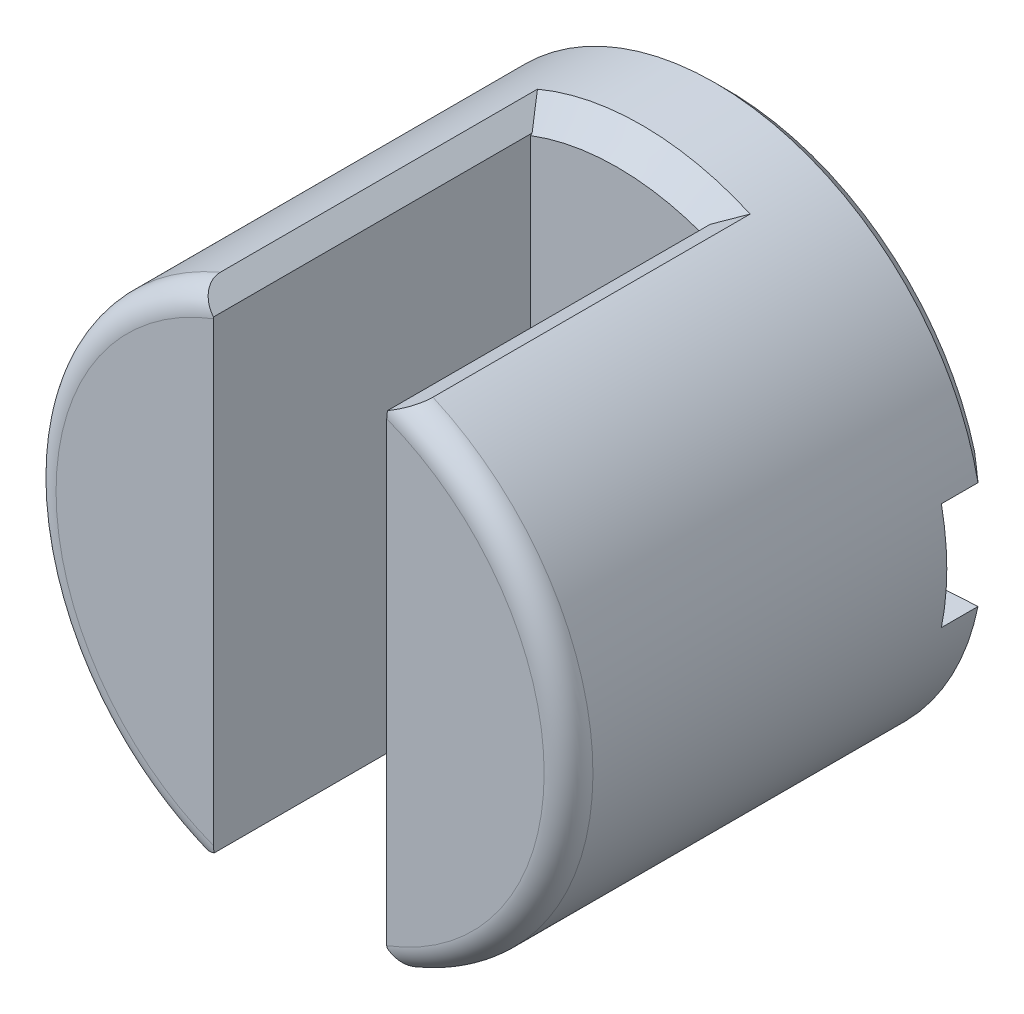
from build123d import *

# Parameters (mm, degrees)
PILL_SLOT_DEPTH           = 13
BASE_START                = -4.5
SKETCH2_5_R               = 11
BASE_DEPTH                = 4.5
SKETCH3_R                 = 3.5
SERVO_ROTATION_SLOT_DEPTH = 2
CHAMFER1_SIZE             = 0.787885924
CHAMFER1_SIZE_2           = 1
FILLET1_R                 = 1
CHAMFER2_SIZE             = 0.5
CHAMFER4_SIZE             = 1


with BuildPart() as part:
    # Sketch2 → Pill Slot (new body)
    with BuildSketch(Plane.XY):
        with BuildLine():
            ThreePointArc((11, 0), (8.945669343, 6.401171768), (3.55, 10.411412008))
            Line((3.55, 10.411412008), (3.55, 0))
            Line((3.55, 0), (11, 0))
        make_face()
        with BuildLine():
            Line((11, 0), (3.55, 0))
            Line((3.55, 0), (3.55, -10.411412008))
            ThreePointArc((3.55, -10.411412008), (8.945669343, -6.401171768), (11, 0))
        make_face()
        with BuildLine():
            Line((-3.55, -10.411412008), (-3.55, 10.411412008))
            ThreePointArc((-3.55, 10.411412008), (-11, 0), (-3.55, -10.411412008))
        make_face()
    extrude(amount=PILL_SLOT_DEPTH)

    # Sketch2<5> → Base (add)
    with BuildSketch(Plane.XY.offset(BASE_START)):
        with Locations(Location((0, 0, 0), (0, 0, 108.827939217))):
            Circle(SKETCH2_5_R)
    extrude(amount=BASE_DEPTH)

    # Sketch3 → Servo Rotation slot (cut)
    with BuildSketch(Plane(origin=(0, 0, -4.5), x_dir=(-1, 0, 0), z_dir=(0, 0, -1))):
        with BuildLine():
            Line((-2.227105745, 2.7), (-10.778529281, 2.196202755))
            ThreePointArc((-10.778529281, 2.196202755), (-11, 0), (-10.778529281, -2.196202755))
            Line((-10.778529281, -2.196202755), (-2.227105745, -2.7))
            ThreePointArc((-2.227105745, -2.7), (-3.5, 0), (-2.227105745, 2.7))
        make_face()
        Circle(SKETCH3_R)
        with BuildLine():
            ThreePointArc((11, 0), (10.94449227, 1.103670673), (10.778529281, 2.196202755))
            Line((10.778529281, 2.196202755), (2.227105745, 2.7))
            ThreePointArc((2.227105745, 2.7), (3.165822966, 1.492502913), (3.5, 0))
            ThreePointArc((3.5, 0), (3.165822966, -1.492502913), (2.227105745, -2.7))
            Line((2.227105745, -2.7), (10.778529281, -2.196202755))
            ThreePointArc((10.778529281, -2.196202755), (10.94449227, -1.103670673), (11, 0))
        make_face()
    extrude(amount=-SERVO_ROTATION_SLOT_DEPTH, mode=Mode.SUBTRACT)

    # Chamfer1
    # the kernel refuses this chamfer: 1, 0.787885924 mm, written as the material it takes off along each edge
    with BuildSketch(Plane(origin=(3.55, 10.411412008, 0), x_dir=(0.9315227050820926, -0.36368317244071224, 0), z_dir=(0, 0, 1))) as chamfer1_piece_1:
        with BuildLine():
            Line((0.959099491, 0), (CHAMFER1_SIZE * 0.363683172432, -CHAMFER1_SIZE * 0.93152270506))
            Line((CHAMFER1_SIZE * 0.363683172432, -CHAMFER1_SIZE * 0.93152270506), (0, 0))
            ThreePointArc((0, 0), (0.493056629, 0.010449768), (0.959099491, 0))
        make_face()
    extrude(amount=15.466411675, mode=Mode.SUBTRACT)
    with BuildSketch(Plane(origin=(3.55, -10.411412008, 0), x_dir=(0.9345365261076723, 0.35586722435566304, 0), z_dir=(0, 0, 1))) as chamfer1_piece_2:
        with BuildLine():
            Line((0.77495125, 0), (CHAMFER1_SIZE_2 * 0.355867224356, CHAMFER1_SIZE_2 * 0.934536526108))
            Line((CHAMFER1_SIZE_2 * 0.355867224356, CHAMFER1_SIZE_2 * 0.934536526108), (0, 0))
            ThreePointArc((0, 0), (0.395650754, -0.006823506), (0.77495125, 0))
        make_face()
    extrude(amount=15.571682988, mode=Mode.SUBTRACT)
    with BuildSketch(Plane(origin=(-3.55, 10.411412008, 0), x_dir=(0, -1, 0), z_dir=(0, 0, 1))) as chamfer1_piece_3:
        with BuildLine():
            Line((CHAMFER1_SIZE_2, 0), (0.275779751, -0.724220249))
            ThreePointArc((0.275779751, -0.724220249), (0.13442232, -0.372178343), (0, 0))
            Line((0, 0), (CHAMFER1_SIZE_2, 0))
        make_face()
    extrude(amount=15.571682988, mode=Mode.SUBTRACT)
    with BuildSketch(Plane(origin=(-3.55, -10.411412008, 0), x_dir=(0, 1, 0), z_dir=(0, 0, 1))) as chamfer1_piece_4:
        with BuildLine():
            Line((CHAMFER1_SIZE, 0), (0.348808346, 0.893422953))
            ThreePointArc((0.348808346, 0.893422953), (0.169582203, 0.463093849), (0, 0))
            Line((0, 0), (CHAMFER1_SIZE, 0))
        make_face()
    extrude(amount=15.466411675, mode=Mode.SUBTRACT)

    # Fillet1
    fillet1_edges = [part.edges().sort_by_distance(p)[0] for p in [
        (-10.999614053, 0.0921449, 13),
        (10.999614053, -0.0921449, 13),
    ]]
    fillet(fillet1_edges, radius=FILLET1_R)

    # Chamfer2
    chamfer2_edges = [part.edges().sort_by_distance(p)[0] for p in [
        (5.471318366, 9.542781321, -4.5),
        (0, -11, -4.5),
        (6.502817513, 2.448101378, -4.5),
        (-6.502817513, -2.448101378, -4.5),
        (6.502817513, -2.448101378, -4.5),
        (0, -3.5, -4.5),
        (-6.502817513, 2.448101378, -4.5),
        (0, 3.5, -4.5),
    ]]
    chamfer(chamfer2_edges, length=CHAMFER2_SIZE)

    # Chamfer4
    # the kernel refuses this chamfer: 1 mm, written as the material it takes off along each edge
    with BuildSketch(Plane(origin=(0, 0, 0), x_dir=(0.6048985718771838, 0.79630252903086, 0), z_dir=(0.79630252903086, -0.6048985718771838, 0))) as chamfer4_piece_1_section:
        Polygon((11, -CHAMFER4_SIZE), (11 - CHAMFER4_SIZE, 0), (11, 0), align=None)
    chamfer4_piece_1 = revolve(axis=Axis((0, 0, 0), (0, 0, 1)), revolution_arc=56.049482755, mode=Mode.PRIVATE)
    chamfer4_piece_1 = split(chamfer4_piece_1, bisect_by=Plane(origin=(3.55, 0, 0), z_dir=(-1, 0, 0)), keep=Keep.TOP, mode=Mode.PRIVATE)
    chamfer4_piece_1 = split(chamfer4_piece_1, bisect_by=Plane(origin=(-3.11882364, 6.346096367, 0), z_dir=(0.44106826903235785, -0.8974735550715685, 0)), keep=Keep.TOP, mode=Mode.PRIVATE)
    add(chamfer4_piece_1, mode=Mode.SUBTRACT)
    with BuildSketch(Plane(origin=(0, 0, 0), x_dir=(0.6048985718771838, 0.79630252903086, 0), z_dir=(0.79630252903086, -0.6048985718771838, 0))) as chamfer4_piece_2_section:
        Polygon((11, -CHAMFER4_SIZE), (11 - CHAMFER4_SIZE, 0), (11, 0), align=None)
    chamfer4_piece_2 = revolve(axis=Axis((0, 0, 0), (0, 0, 1)), revolution_arc=56.049482755, mode=Mode.PRIVATE)
    chamfer4_piece_2 = split(chamfer4_piece_2, bisect_by=Plane(origin=(3.55, 0, 0), z_dir=(1, 0, 0)), keep=Keep.TOP, mode=Mode.PRIVATE)
    chamfer4_piece_2 = split(chamfer4_piece_2, bisect_by=Plane(origin=(-3.11882364, 6.346096367, 0), z_dir=(-0.44106826903235785, 0.8974735550715685, 0)), keep=Keep.TOP, mode=Mode.PRIVATE)
    add(chamfer4_piece_2, mode=Mode.SUBTRACT)
    with BuildSketch(Plane(origin=(0, 0, 0), x_dir=(0.6048985718771838, 0.79630252903086, 0), z_dir=(0.79630252903086, -0.6048985718771838, 0))) as chamfer4_piece_3_section:
        Polygon((11, -CHAMFER4_SIZE), (11 - CHAMFER4_SIZE, 0), (11, 0), align=None)
    chamfer4_piece_3 = revolve(axis=Axis((0, 0, 0), (0, 0, 1)), revolution_arc=56.049482755, mode=Mode.PRIVATE)
    chamfer4_piece_3 = split(chamfer4_piece_3, bisect_by=Plane(origin=(3.55, 0, 0), z_dir=(-1, 0, 0)), keep=Keep.TOP, mode=Mode.PRIVATE)
    chamfer4_piece_3 = split(chamfer4_piece_3, bisect_by=Plane(origin=(-3.11882364, 6.346096367, 0), z_dir=(-0.44106826903235785, 0.8974735550715685, 0)), keep=Keep.TOP, mode=Mode.PRIVATE)
    add(chamfer4_piece_3, mode=Mode.SUBTRACT)
    with BuildSketch(Plane(origin=(0, 0, 0), x_dir=(-0.6048985718728862, -0.7963025290341244, 0), z_dir=(-0.7963025290341244, 0.6048985718728862, 0))) as chamfer4_piece_4_section:
        Polygon((11, -CHAMFER4_SIZE), (11 - CHAMFER4_SIZE, 0), (11, 0), align=None)
    chamfer4_piece_4 = revolve(axis=Axis((0, 0, 0), (0, 0, 1)), revolution_arc=56.049482754, mode=Mode.PRIVATE)
    chamfer4_piece_4 = split(chamfer4_piece_4, bisect_by=Plane(origin=(-3.55, 0, 0), z_dir=(1, 0, 0)), keep=Keep.TOP, mode=Mode.PRIVATE)
    chamfer4_piece_4 = split(chamfer4_piece_4, bisect_by=Plane(origin=(3.11882364, -6.346096367, 0), z_dir=(-0.44106826904770263, 0.8974735550640272, 0)), keep=Keep.TOP, mode=Mode.PRIVATE)
    add(chamfer4_piece_4, mode=Mode.SUBTRACT)
    with BuildSketch(Plane(origin=(0, 0, 0), x_dir=(-0.6048985718728862, -0.7963025290341244, 0), z_dir=(-0.7963025290341244, 0.6048985718728862, 0))) as chamfer4_piece_5_section:
        Polygon((11, -CHAMFER4_SIZE), (11 - CHAMFER4_SIZE, 0), (11, 0), align=None)
    chamfer4_piece_5 = revolve(axis=Axis((0, 0, 0), (0, 0, 1)), revolution_arc=56.049482754, mode=Mode.PRIVATE)
    chamfer4_piece_5 = split(chamfer4_piece_5, bisect_by=Plane(origin=(-3.55, 0, 0), z_dir=(-1, 0, 0)), keep=Keep.TOP, mode=Mode.PRIVATE)
    chamfer4_piece_5 = split(chamfer4_piece_5, bisect_by=Plane(origin=(3.11882364, -6.346096367, 0), z_dir=(0.44106826904770263, -0.8974735550640272, 0)), keep=Keep.TOP, mode=Mode.PRIVATE)
    add(chamfer4_piece_5, mode=Mode.SUBTRACT)
    with BuildSketch(Plane(origin=(0, 0, 0), x_dir=(-0.6048985718728862, -0.7963025290341244, 0), z_dir=(-0.7963025290341244, 0.6048985718728862, 0))) as chamfer4_piece_6_section:
        Polygon((11, -CHAMFER4_SIZE), (11 - CHAMFER4_SIZE, 0), (11, 0), align=None)
    chamfer4_piece_6 = revolve(axis=Axis((0, 0, 0), (0, 0, 1)), revolution_arc=56.049482754, mode=Mode.PRIVATE)
    chamfer4_piece_6 = split(chamfer4_piece_6, bisect_by=Plane(origin=(-3.55, 0, 0), z_dir=(1, 0, 0)), keep=Keep.TOP, mode=Mode.PRIVATE)
    chamfer4_piece_6 = split(chamfer4_piece_6, bisect_by=Plane(origin=(3.11882364, -6.346096367, 0), z_dir=(0.44106826904770263, -0.8974735550640272, 0)), keep=Keep.TOP, mode=Mode.PRIVATE)
    add(chamfer4_piece_6, mode=Mode.SUBTRACT)
    with BuildSketch(Plane(origin=(0, -1e-09, 0), x_dir=(0.32272727272524954, -0.9464920007265367, 0), z_dir=(-0.9464920007265367, -0.32272727272524954, 0))) as chamfer4_piece_7_section:
        Polygon((10.999999999, -CHAMFER4_SIZE), (10.999999999 - CHAMFER4_SIZE, 0), (10.999999999, 0), align=None)
    chamfer4_piece_7 = revolve(axis=Axis((0, -1e-09, 0), (0, 0, 1)), revolution_arc=17.432483992, mode=Mode.PRIVATE)
    chamfer4_piece_7 = split(chamfer4_piece_7, bisect_by=Plane(origin=(-2.930706004, -2.930706004, 0), z_dir=(-0.7071067811864781, -0.7071067811866171, 0)), keep=Keep.TOP, mode=Mode.PRIVATE)
    chamfer4_piece_7 = split(chamfer4_piece_7, bisect_by=Plane(origin=(3.55, -1e-09, 0), z_dir=(1, 0, 0)), keep=Keep.TOP, mode=Mode.PRIVATE)
    add(chamfer4_piece_7, mode=Mode.SUBTRACT)
    with BuildSketch(Plane(origin=(0, -1e-09, 0), x_dir=(0.32272727272524954, -0.9464920007265367, 0), z_dir=(-0.9464920007265367, -0.32272727272524954, 0))) as chamfer4_piece_8_section:
        Polygon((10.999999999, -CHAMFER4_SIZE), (10.999999999 - CHAMFER4_SIZE, 0), (10.999999999, 0), align=None)
    chamfer4_piece_8 = revolve(axis=Axis((0, -1e-09, 0), (0, 0, 1)), revolution_arc=17.432483992, mode=Mode.PRIVATE)
    chamfer4_piece_8 = split(chamfer4_piece_8, bisect_by=Plane(origin=(-2.930706004, -2.930706004, 0), z_dir=(-0.7071067811864781, -0.7071067811866171, 0)), keep=Keep.TOP, mode=Mode.PRIVATE)
    chamfer4_piece_8 = split(chamfer4_piece_8, bisect_by=Plane(origin=(3.55, -1e-09, 0), z_dir=(-1, 0, 0)), keep=Keep.TOP, mode=Mode.PRIVATE)
    add(chamfer4_piece_8, mode=Mode.SUBTRACT)
    with BuildSketch(Plane(origin=(0, -1e-09, 0), x_dir=(0.32272727272524954, -0.9464920007265367, 0), z_dir=(-0.9464920007265367, -0.32272727272524954, 0))) as chamfer4_piece_9_section:
        Polygon((10.999999999, -CHAMFER4_SIZE), (10.999999999 - CHAMFER4_SIZE, 0), (10.999999999, 0), align=None)
    chamfer4_piece_9 = revolve(axis=Axis((0, -1e-09, 0), (0, 0, 1)), revolution_arc=17.432483992, mode=Mode.PRIVATE)
    chamfer4_piece_9 = split(chamfer4_piece_9, bisect_by=Plane(origin=(-2.930706004, -2.930706004, 0), z_dir=(0.7071067811864781, 0.7071067811866171, 0)), keep=Keep.TOP, mode=Mode.PRIVATE)
    chamfer4_piece_9 = split(chamfer4_piece_9, bisect_by=Plane(origin=(3.55, -1e-09, 0), z_dir=(-1, 0, 0)), keep=Keep.TOP, mode=Mode.PRIVATE)
    add(chamfer4_piece_9, mode=Mode.SUBTRACT)
    with BuildSketch(Plane(origin=(0, 0, 0), x_dir=(-0.32272727272727286, 0.9464920007258469, 0), z_dir=(0.9464920007258469, 0.32272727272727286, 0))) as chamfer4_piece_10_section:
        Polygon((11, -CHAMFER4_SIZE), (11 - CHAMFER4_SIZE, 0), (11, 0), align=None)
    chamfer4_piece_10 = revolve(axis=Axis((0, 0, 0), (0, 0, 1)), revolution_arc=17.43248399, mode=Mode.PRIVATE)
    chamfer4_piece_10 = split(chamfer4_piece_10, bisect_by=Plane(origin=(2.930706004, 2.930706004, 0), z_dir=(0.7071067811865476, 0.7071067811865476, 0)), keep=Keep.TOP, mode=Mode.PRIVATE)
    chamfer4_piece_10 = split(chamfer4_piece_10, bisect_by=Plane(origin=(-3.55, 0, 0), z_dir=(-1, 0, 0)), keep=Keep.TOP, mode=Mode.PRIVATE)
    add(chamfer4_piece_10, mode=Mode.SUBTRACT)
    with BuildSketch(Plane(origin=(0, 0, 0), x_dir=(-0.32272727272727286, 0.9464920007258469, 0), z_dir=(0.9464920007258469, 0.32272727272727286, 0))) as chamfer4_piece_11_section:
        Polygon((11, -CHAMFER4_SIZE), (11 - CHAMFER4_SIZE, 0), (11, 0), align=None)
    chamfer4_piece_11 = revolve(axis=Axis((0, 0, 0), (0, 0, 1)), revolution_arc=17.43248399, mode=Mode.PRIVATE)
    chamfer4_piece_11 = split(chamfer4_piece_11, bisect_by=Plane(origin=(2.930706004, 2.930706004, 0), z_dir=(0.7071067811865476, 0.7071067811865476, 0)), keep=Keep.TOP, mode=Mode.PRIVATE)
    chamfer4_piece_11 = split(chamfer4_piece_11, bisect_by=Plane(origin=(-3.55, 0, 0), z_dir=(1, 0, 0)), keep=Keep.TOP, mode=Mode.PRIVATE)
    add(chamfer4_piece_11, mode=Mode.SUBTRACT)
    with BuildSketch(Plane(origin=(0, 0, 0), x_dir=(-0.32272727272727286, 0.9464920007258469, 0), z_dir=(0.9464920007258469, 0.32272727272727286, 0))) as chamfer4_piece_12_section:
        Polygon((11, -CHAMFER4_SIZE), (11 - CHAMFER4_SIZE, 0), (11, 0), align=None)
    chamfer4_piece_12 = revolve(axis=Axis((0, 0, 0), (0, 0, 1)), revolution_arc=17.43248399, mode=Mode.PRIVATE)
    chamfer4_piece_12 = split(chamfer4_piece_12, bisect_by=Plane(origin=(2.930706004, 2.930706004, 0), z_dir=(-0.7071067811865476, -0.7071067811865476, 0)), keep=Keep.TOP, mode=Mode.PRIVATE)
    chamfer4_piece_12 = split(chamfer4_piece_12, bisect_by=Plane(origin=(-3.55, 0, 0), z_dir=(1, 0, 0)), keep=Keep.TOP, mode=Mode.PRIVATE)
    add(chamfer4_piece_12, mode=Mode.SUBTRACT)


solid = part.part
